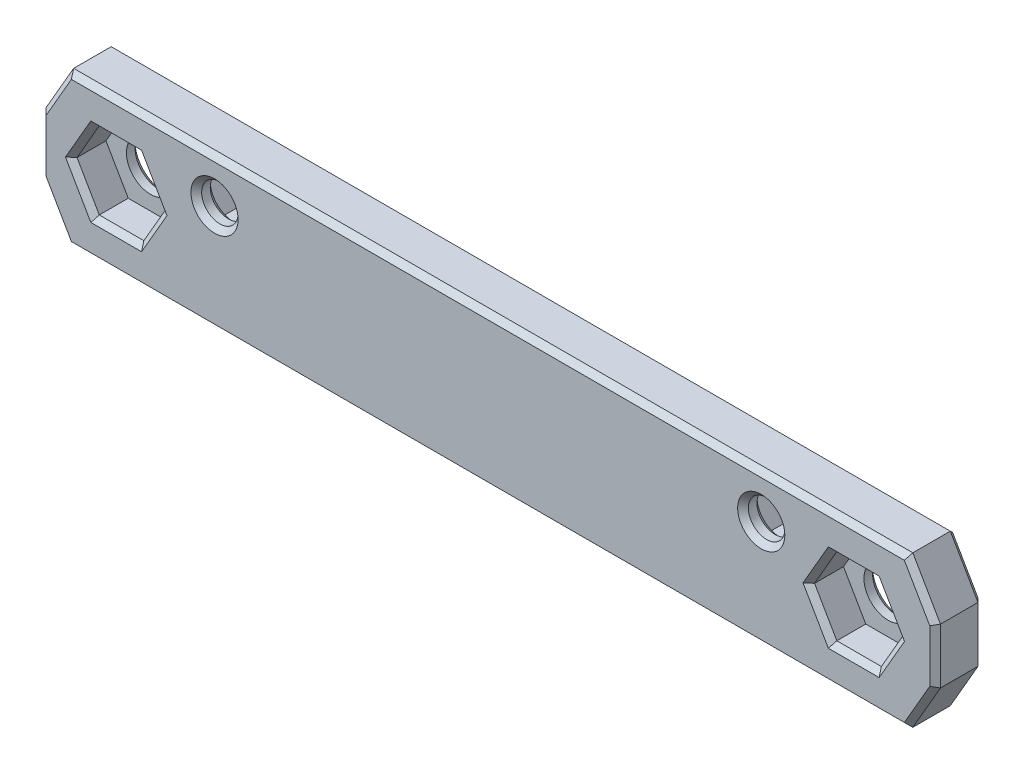
from build123d import *

# Parameters (mm, degrees)
SKETCH1_W            = 92
SKETCH1_H            = 75
BOSS_EXTRUDE1_DEPTH  = 4.5
M4_CLEARANCE_HOLE1_D = 4.5
M3_CLEARANCE_HOLE1_D = 3.4
CUT_EXTRUDE1_DEPTH   = 3.2
CUT_EXTRUDE2_DEPTH   = 2.7
SKETCH10_W           = 92
SKETCH10_H           = 29.25
SKETCH10_H_2         = 28.3
CUT_EXTRUDE3_DEPTH   = 60.51890456
CUT_EXTRUDE4_DEPTH   = 10
CHAMFER1_SIZE        = 0.5
CHAMFER2_SIZE        = 0.5


with BuildPart() as part:
    # Sketch1 → Boss-Extrude1 (new body)
    with BuildSketch(Plane.XY):
        Rectangle(SKETCH1_W, SKETCH1_H)
    extrude(amount=BOSS_EXTRUDE1_DEPTH)

    # M4 Clearance Hole1 (through all)
    with Locations(Plane.XY.offset(4.5)):
        with Locations((-34.669877487, -1.6), (34.130122513, -1.6)):
            Hole(M4_CLEARANCE_HOLE1_D / 2)

    # M3 Clearance Hole1 (through all)
    with Locations(Plane.XY.offset(4.5)):
        with Locations((-25.5, 1.4), (25.5, 1.4)):
            Hole(M3_CLEARANCE_HOLE1_D / 2)

    # Sketch8 → Cut-Extrude1 (cut)
    with BuildSketch(Plane.XY.offset(4.5)):
        Polygon((-30.512955548, -1.6), (-32.591416518, 2), (-36.748338456, 2), (-38.826799425, -1.6), (-36.748338456, -5.2), (-32.591416518, -5.2), align=None)
        Polygon((29.973200575, -1.6), (32.051661544, -5.2), (36.208583482, -5.2), (38.287044452, -1.6), (36.208583482, 2), (32.051661544, 2), align=None)
    extrude(amount=-CUT_EXTRUDE1_DEPTH, mode=Mode.SUBTRACT)

    # Sketch9 → Cut-Extrude2 (cut)
    with BuildSketch(Plane(origin=(0, 0, 0), x_dir=(-1, 0, 0), z_dir=(0, 0, -1))):
        Polygon((-22.209103466, 1.4), (-23.854551733, 4.25), (-27.145448267, 4.25), (-28.790896534, 1.4), (-27.145448267, -1.45), (-23.854551733, -1.45), align=None)
        Polygon((22.209103466, 1.4), (23.854551733, -1.45), (27.145448267, -1.45), (28.790896534, 1.4), (27.145448267, 4.25), (23.854551733, 4.25), align=None)
    extrude(amount=-CUT_EXTRUDE2_DEPTH, mode=Mode.SUBTRACT)

    # Sketch10 → Cut-Extrude3 (cut, through all)
    with BuildSketch(Plane(origin=(0, 0, 0), x_dir=(-1, 0, 0), z_dir=(0, 0, -1))):
        with Locations((0, 22.875)):
            Rectangle(SKETCH10_W, SKETCH10_H)
        with Locations((0, -23.35)):
            Rectangle(SKETCH10_W, SKETCH10_H_2)
    extrude(amount=-CUT_EXTRUDE3_DEPTH, mode=Mode.SUBTRACT)

    # Sketch11 → Cut-Extrude4 (cut)
    with BuildSketch(Plane.XY.offset(4.5)):
        Polygon((-39.13939839, 5.45), (-41.719877487, 0.980479097), (-41.719877487, -4.180479097), (-39.13939839, -8.65), (0, -8.65), (0, -18.65), (-51, -18.65), (-51, 15.45), (0, 15.45), (0, 5.45), align=None)
    cut_extrude4 = extrude(amount=-CUT_EXTRUDE4_DEPTH, mode=Mode.SUBTRACT)

    # Mirror1: Cut-Extrude4 across plane
    add(cut_extrude4.mirror(Plane(origin=(0, 0, 0), x_dir=(0, 0, 1), z_dir=(1, 0, 0))), mode=Mode.SUBTRACT)

    # Chamfer1
    chamfer1_edges = [part.edges().sort_by_distance(p)[0] for p in [
        (41.719877487, -1.6, 4.5),
        (40.429637938, -6.415239548, 4.5),
        (0, -8.65, 4.5),
        (-40.429637938, -6.415239548, 4.5),
        (-41.719877487, -1.6, 4.5),
        (-40.429637938, 3.215239548, 4.5),
        (0, 5.45, 4.5),
        (40.429637938, 3.215239548, 4.5),
        (27.2, 1.4, 4.5),
        (-23.8, 1.4, 4.5),
        (31.01243106, -3.4, 4.5),
        (34.130122513, -5.2, 4.5),
        (37.247813967, -3.4, 4.5),
        (37.247813967, 0.2, 4.5),
        (34.130122513, 2, 4.5),
        (31.01243106, 0.2, 4.5),
        (-31.552186033, 0.2, 4.5),
        (-34.669877487, 2, 4.5),
        (-37.78756894, 0.2, 4.5),
        (-37.78756894, -3.4, 4.5),
        (-34.669877487, -5.2, 4.5),
        (-31.552186033, -3.4, 4.5),
        (-40.429637938, 3.215239548, 0),
        (-41.719877487, -1.6, 0),
        (-40.429637938, -6.415239548, 0),
        (0, -8.65, 0),
        (40.429637938, -6.415239548, 0),
        (41.719877487, -1.6, 0),
        (40.429637938, 3.215239548, 0),
        (0, 5.45, 0),
        (25.5, 4.25, 0),
        (27.968172401, 2.825, 0),
        (27.968172401, -0.025, 0),
        (25.5, -1.45, 0),
        (23.031827599, -0.025, 0),
        (23.031827599, 2.825, 0),
        (-25.5, -1.45, 0),
        (-27.968172401, -0.025, 0),
        (-27.968172401, 2.825, 0),
        (-25.5, 4.25, 0),
        (-23.031827599, 2.825, 0),
        (-23.031827599, -0.025, 0),
        (-32.419877487, -1.6, 0),
        (36.380122513, -1.6, 0),
    ]]
    chamfer(chamfer1_edges, length=CHAMFER1_SIZE)

    # Chamfer2
    chamfer2_edges = [part.edges().sort_by_distance(p)[0] for p in [
        (-23.8, 1.4, 2.7),
        (27.2, 1.4, 2.7),
    ]]
    chamfer(chamfer2_edges, length=CHAMFER2_SIZE)


solid = part.part
